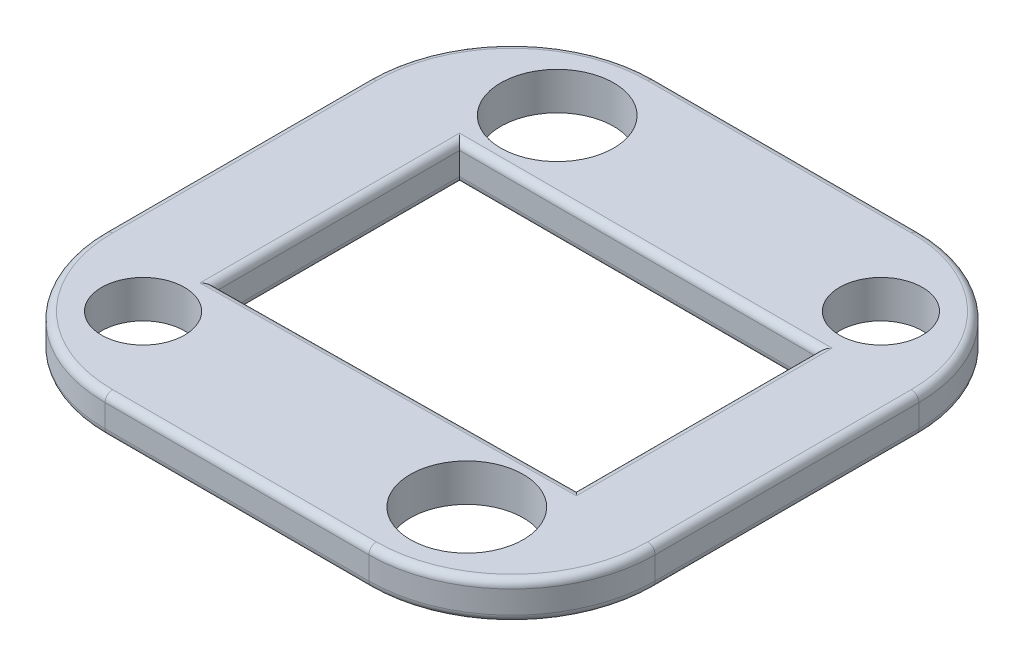
from build123d import *

# Parameters (mm, degrees)
SKETCH1_R           = 7.5
SKETCH1_R_2         = 5.5
BOSS_EXTRUDE2_DEPTH = 5
BOSS_EXTRUDE3_START = -5
BOSS_EXTRUDE3_DEPTH = 5
BOSS_EXTRUDE4_START = -5
BOSS_EXTRUDE4_DEPTH = 5
SKETCH4_W           = 9.546640849
SKETCH4_H           = 34.760778113
BOSS_EXTRUDE7_DEPTH = 5
CUT_EXTRUDE1_START  = -16
CUT_EXTRUDE1_DEPTH  = 16
FILLET4_R           = 1
FILLET5_R           = 1


with BuildPart() as part:
    # Sketch1 → Boss-Extrude2 (new body)
    with BuildSketch(Plane(origin=(0, 0, 0), x_dir=(1, 0, 0), z_dir=(0, 1, 0))):
        with BuildLine():
            Line((20, 0), (55, 0))
            ThreePointArc((55, 0), (69.142135624, 5.857864376), (75, 20))
            Line((75, 20), (75, 55))
            ThreePointArc((75, 55), (69.142135624, 69.142135624), (55, 75))
            Line((55, 75), (20, 75))
            ThreePointArc((20, 75), (5.857864376, 69.142135624), (0, 55))
            Line((0, 55), (0, 20))
            ThreePointArc((0, 20), (5.857864376, 5.857864376), (20, 0))
        make_face()
        with Locations((18, 63)):
            Circle(SKETCH1_R, mode=Mode.SUBTRACT)
        with Locations((13.02, 13.02)):
            Circle(SKETCH1_R_2, mode=Mode.SUBTRACT)
        with Locations((61.98, 61.98)):
            Circle(SKETCH1_R_2, mode=Mode.SUBTRACT)
        with Locations((57, 12)):
            Circle(SKETCH1_R, mode=Mode.SUBTRACT)
        with BuildLine():
            Line((27.013878189, 60), (54.746079901, 60))
            ThreePointArc((54.746079901, 60), (61.98, 54.48), (69.213920099, 60))
            Line((69.213920099, 60), (70, 60))
            Line((70, 60), (70, 15))
            Line((70, 15), (66.013878189, 15))
            ThreePointArc((66.013878189, 15), (57, 21.5), (47.986121811, 15))
            Line((47.986121811, 15), (20.253920099, 15))
            ThreePointArc((20.253920099, 15), (13.02, 20.52), (5.786079901, 15))
            Line((5.786079901, 15), (5, 15))
            Line((5, 15), (5, 60))
            Line((5, 60), (8.986121811, 60))
            ThreePointArc((8.986121811, 60), (18, 53.5), (27.013878189, 60))
        make_face(mode=Mode.SUBTRACT)
    extrude(amount=BOSS_EXTRUDE2_DEPTH)

    # Sketch2 → Boss-Extrude3 (add)
    with BuildSketch(Plane(origin=(0, 5, 0), x_dir=(1, 0, 0), z_dir=(0, 1, 0)).offset(BOSS_EXTRUDE3_START)):
        with BuildLine():
            Line((69.213920099, 60), (70, 60))
            Line((70, 60), (70, 15))
            Line((70, 15), (66.013878189, 15))
            ThreePointArc((66.013878189, 15), (64.445429311, 17.900473063), (61.98, 20.090092707))
            Line((61.98, 20.090092707), (61.98, 54.48))
            ThreePointArc((61.98, 54.48), (66.529725266, 56.017617926), (69.213920099, 60))
        make_face()
    extrude(amount=BOSS_EXTRUDE3_DEPTH)

    # Sketch3 → Boss-Extrude4 (add)
    with BuildSketch(Plane(origin=(0, 5, 0), x_dir=(1, 0, 0), z_dir=(0, 1, 0)).offset(BOSS_EXTRUDE4_START)):
        with BuildLine():
            Line((5, 53.5), (61.98, 53.5))
            Line((61.98, 53.5), (61.98, 56.48))
            ThreePointArc((61.98, 56.48), (58.868730163, 57.444583812), (56.848762333, 60))
            Line((56.848762333, 60), (54.746079901, 60))
            Line((54.746079901, 60), (27.013878189, 60))
            Line((27.013878189, 60), (24.873863542, 60))
            ThreePointArc((24.873863542, 60), (18, 55.5), (11.126136458, 60))
            Line((11.126136458, 60), (8.986121811, 60))
            Line((8.986121811, 60), (5, 60))
            Line((5, 60), (5, 53.5))
        make_face()
        with BuildLine():
            Line((61.98, 21.550493331), (5, 20.978241969))
            Line((5, 20.978241969), (5, 15))
            Line((5, 15), (7.888762333, 15))
            ThreePointArc((7.888762333, 15), (13.02, 18.52), (18.151237667, 15))
            Line((18.151237667, 15), (47.986121811, 15))
            Line((47.986121811, 15), (50.126136458, 15))
            ThreePointArc((50.126136458, 15), (55.388451571, 19.324814787), (61.98, 17.607994294))
            Line((61.98, 17.607994294), (61.98, 21.550493331))
        make_face()
    extrude(amount=BOSS_EXTRUDE4_DEPTH)

    # Sketch4 → Boss-Extrude7 (add)
    with BuildSketch(Plane(origin=(0, 5, 0), x_dir=(1, 0, 0), z_dir=(0, 1, 0))):
        with Locations((9.773320424, 37.219087726)):
            Rectangle(SKETCH4_W, SKETCH4_H)
    extrude(amount=-BOSS_EXTRUDE7_DEPTH)

    # Sketch5 → Cut-Extrude1 (cut)
    with BuildSketch(Plane(origin=(0, 5, 0), x_dir=(1, 0, 0), z_dir=(0, 1, 0)).offset(CUT_EXTRUDE1_START)):
        with BuildLine():
            Line((55, 75), (20, 75))
            ThreePointArc((20, 75), (5.857864376, 69.142135624), (0, 55))
            Line((0, 55), (0, 20))
            ThreePointArc((0, 20), (5.857864376, 5.857864376), (20, 0))
            Line((20, 0), (55, 0))
            ThreePointArc((55, 0), (69.142135624, 5.857864376), (75, 20))
            Line((75, 20), (75, 55))
            ThreePointArc((75, 55), (69.142135624, 69.142135624), (55, 75))
        make_face()
        with BuildLine():
            Line((1, 55), (1, 20))
            ThreePointArc((1, 20), (6.564971157, 6.564971157), (20, 1))
            Line((20, 1), (55, 1))
            ThreePointArc((55, 1), (68.435028843, 6.564971157), (74, 20))
            Line((74, 20), (74, 55))
            ThreePointArc((74, 55), (68.435028843, 68.435028843), (55, 74))
            Line((55, 74), (20, 74))
            ThreePointArc((20, 74), (6.564971157, 68.435028843), (1, 55))
        make_face(mode=Mode.SUBTRACT)
    extrude(amount=CUT_EXTRUDE1_DEPTH, mode=Mode.SUBTRACT)

    # Fillet4
    fillet4_edges = [part.edges().sort_by_distance(p)[0] for p in [
        (37.5, 0, -74),
        (6.564971157, 0, -68.435028843),
        (1, 0, -37.5),
        (6.564971157, 0, -6.564971157),
        (37.5, 0, -1),
        (68.435028843, 0, -6.564971157),
        (74, 0, -37.5),
        (74, 5, -37.5),
        (68.435028843, 5, -6.564971157),
        (37.5, 5, -1),
        (6.564971157, 5, -6.564971157),
        (1, 5, -37.5),
        (6.564971157, 5, -68.435028843),
        (37.5, 5, -74),
        (61.98, 5, -37.525246665),
        (38.263320425, 5, -21.312306209),
        (14.546640849, 5, -37.287059544),
        (14.546640849, 0, -37.287059544),
        (38.263320425, 0, -21.312306209),
        (61.98, 0, -37.525246665),
        (68.435028843, 0, -68.435028843),
        (68.435028843, 5, -68.435028843),
        (38.263320425, 5, -53.5),
    ]]
    fillet(fillet4_edges, radius=FILLET4_R)

    # Fillet5
    fillet5_edges = [part.edges().sort_by_distance(p)[0] for p in [
        (38.263320425, 0, -53.5),
    ]]
    fillet(fillet5_edges, radius=FILLET5_R)


solid = part.part
